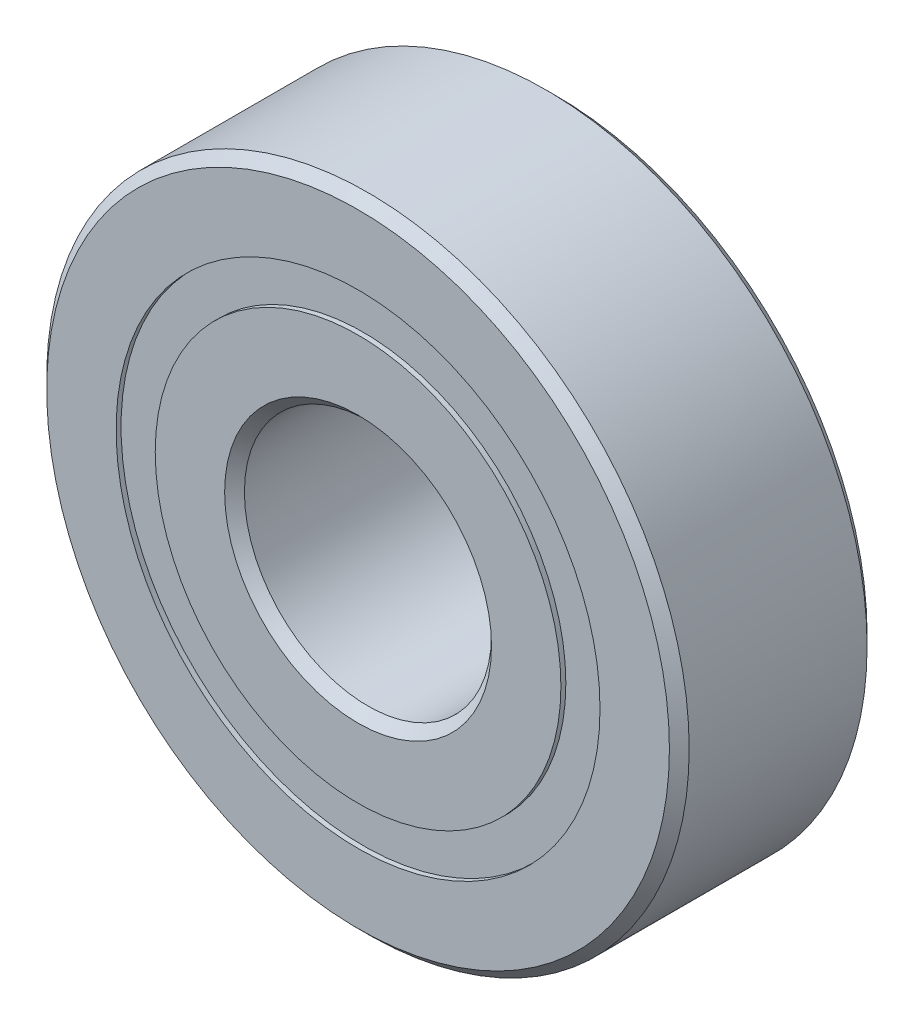
from build123d import *

# Parameters (mm, degrees)
CIRPATTERN1_COUNT = 12
SKETCH5_W         = 0.927052779
SKETCH5_H         = 0.791208792


with BuildPart() as part:
    # Sketch1 → Revolve1 (revolve)
    with BuildSketch(Plane(origin=(0, 0, 0), x_dir=(0, 0, -1), z_dir=(1, 0, 0))):
        with BuildLine():
            Line((1.8, 6.5), (-1.8, 6.5))
            Line((-1.8, 6.5), (-2, 6.3))
            Line((-2, 6.3), (-2, 4.895604396))
            Line((-2, 4.895604396), (-0.888888889, 4.895604396))
            ThreePointArc((-0.888888889, 4.895604396), (0, 5.472947221), (0.888888889, 4.895604396))
            Line((0.888888889, 4.895604396), (2, 4.895604396))
            Line((2, 4.895604396), (2, 6.3))
            Line((2, 6.3), (1.8, 6.5))
        make_face()
    revolve(axis=Axis((0, 0, 2), (0, 0, -1)))


with BuildPart() as body_2:
    # Sketch3 → Revolve3 (revolve)
    with BuildSketch(Plane(origin=(0, 0, 0), x_dir=(0, 0, -1), z_dir=(1, 0, 0))):
        with BuildLine():
            Line((-2, 4.104395604), (-0.888888889, 4.104395604))
            ThreePointArc((-0.888888889, 4.104395604), (0, 3.527052779), (0.888888889, 4.104395604))
            Line((0.888888889, 4.104395604), (2, 4.104395604))
            Line((2, 4.104395604), (2, 2.7))
            Line((2, 2.7), (1.8, 2.5))
            Line((1.8, 2.5), (-1.8, 2.5))
            Line((-1.8, 2.5), (-2, 2.7))
            Line((-2, 2.7), (-2, 4.104395604))
        make_face()
    revolve(axis=Axis((0, 0, 2), (0, 0, -1)))


with BuildPart() as body_3:
    # Sketch4 → Revolve4 (revolve)
    with BuildSketch(Plane(origin=(0, 0, 0), x_dir=(0, 0, -1), z_dir=(1, 0, 0))):
        with BuildLine():
            Line((-0.972947221, 4.5), (0.972947221, 4.5))
            ThreePointArc((0.972947221, 4.5), (0, 5.472947221), (-0.972947221, 4.5))
        make_face()
    revolve(axis=Axis((0, 4.5, 0.972947221), (0, 0, -1)))


with BuildPart() as cirpattern1_1:
    # CirPattern1: pattern copy
    add(body_3.part.rotate(Axis((0, 0, -2), (0, 0, 1)), 1 * 360 / CIRPATTERN1_COUNT))


with BuildPart() as cirpattern1_2:
    # CirPattern1: pattern copy
    add(body_3.part.rotate(Axis((0, 0, -2), (0, 0, 1)), 2 * 360 / CIRPATTERN1_COUNT))


with BuildPart() as cirpattern1_3:
    # CirPattern1: pattern copy
    add(body_3.part.rotate(Axis((0, 0, -2), (0, 0, 1)), 3 * 360 / CIRPATTERN1_COUNT))


with BuildPart() as cirpattern1_4:
    # CirPattern1: pattern copy
    add(body_3.part.rotate(Axis((0, 0, -2), (0, 0, 1)), 4 * 360 / CIRPATTERN1_COUNT))


with BuildPart() as cirpattern1_5:
    # CirPattern1: pattern copy
    add(body_3.part.rotate(Axis((0, 0, -2), (0, 0, 1)), 5 * 360 / CIRPATTERN1_COUNT))


with BuildPart() as cirpattern1_6:
    # CirPattern1: pattern copy
    add(body_3.part.rotate(Axis((0, 0, -2), (0, 0, 1)), 6 * 360 / CIRPATTERN1_COUNT))


with BuildPart() as cirpattern1_7:
    # CirPattern1: pattern copy
    add(body_3.part.rotate(Axis((0, 0, -2), (0, 0, 1)), 7 * 360 / CIRPATTERN1_COUNT))


with BuildPart() as cirpattern1_8:
    # CirPattern1: pattern copy
    add(body_3.part.rotate(Axis((0, 0, -2), (0, 0, 1)), 8 * 360 / CIRPATTERN1_COUNT))


with BuildPart() as cirpattern1_9:
    # CirPattern1: pattern copy
    add(body_3.part.rotate(Axis((0, 0, -2), (0, 0, 1)), 9 * 360 / CIRPATTERN1_COUNT))


with BuildPart() as cirpattern1_10:
    # CirPattern1: pattern copy
    add(body_3.part.rotate(Axis((0, 0, -2), (0, 0, 1)), 10 * 360 / CIRPATTERN1_COUNT))


with BuildPart() as cirpattern1_11:
    # CirPattern1: pattern copy
    add(body_3.part.rotate(Axis((0, 0, -2), (0, 0, 1)), 11 * 360 / CIRPATTERN1_COUNT))


with BuildPart() as body_15:
    # Sketch5 → Revolve5 (revolve)
    with BuildSketch(Plane(origin=(0, 0, 0), x_dir=(0, 0, -1), z_dir=(1, 0, 0))):
        with Locations((-1.436473611, 4.5)):
            Rectangle(SKETCH5_W, SKETCH5_H)
        with Locations((1.436473611, 4.5)):
            Rectangle(SKETCH5_W, SKETCH5_H)
    revolve(axis=Axis((0, 0, 2), (0, 0, -1)))


solid = Compound([part.part, body_2.part, body_3.part, cirpattern1_1.part, cirpattern1_2.part, cirpattern1_3.part, cirpattern1_4.part, cirpattern1_5.part, cirpattern1_6.part, cirpattern1_7.part, cirpattern1_8.part, cirpattern1_9.part, cirpattern1_10.part, cirpattern1_11.part, body_15.part])
